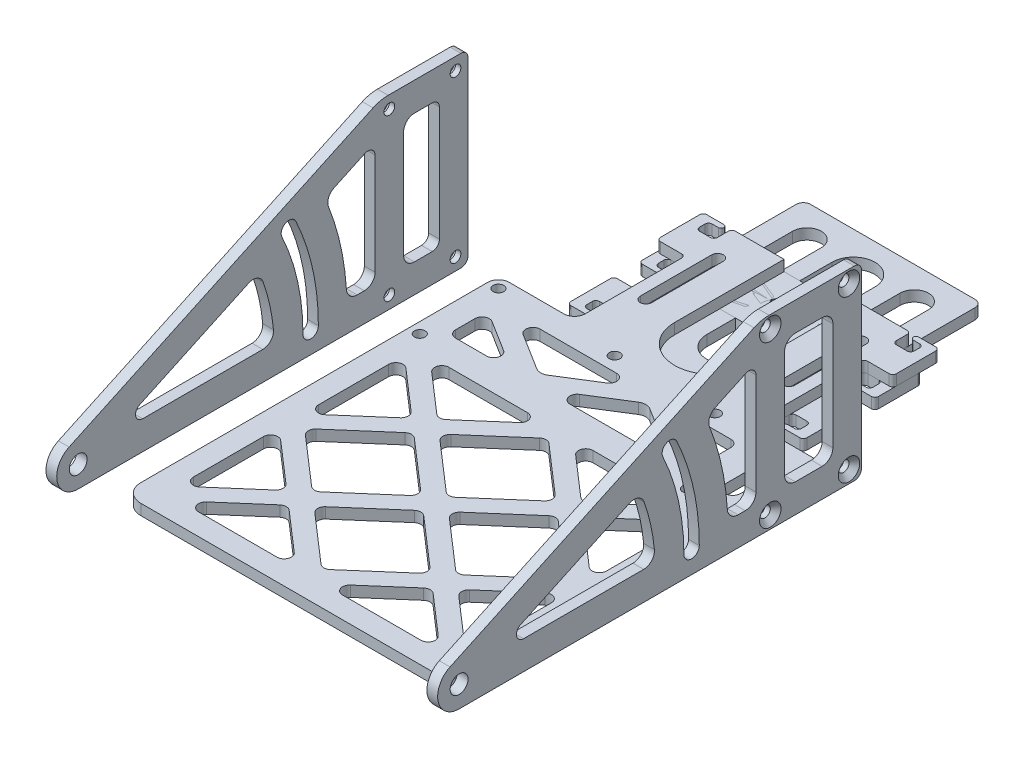
from build123d import *

# Parameters (mm, degrees)
EXTRUDE_START             = 51.75
SKETCH_1_R                = 1.5
SKETCH_1_R_2              = 2.5
EXTRUDE_1_DEPTH           = 3
HOLE_WIZARD_1_D           = 3
HOLE_WIZARD_1_CSINK_D     = 6
HOLE_WIZARD_1_CSINK_ANGLE = 90
CUT_EXTRUDE_2_DEPTH       = 122.355881604
SKETCH_2_R                = 3
EXTRUDE_2_DEPTH           = 3
SKETCH_4_R                = 1.5
SKETCH_4_W                = 3.5
SKETCH_4_H                = 52
CUT_EXTRUDE_1_DEPTH       = 164.427353892
MOVE_START                = 8
MOVE_FACE_1_OUTLINE_W     = 3
MOVE_FACE_1_OUTLINE_H     = 36
MOVE_FACE_1_DEPTH         = 3.5
FILLET_3_R                = 2
HOLE_WIZARD_2_AT_2_COUNT  = 2
HOLE_WIZARD_2_AT_2_PITCH  = 45
SKETCH_5_R                = 1.5
EXTRUDE_3_DEPTH           = 3
SKETCH_6_R                = 1.5
EXTRUDE_4_DEPTH           = 3
FILLET_1_R                = 1
FILLET_2_R                = 1
CUT_EXTRUDE_3_DEPTH       = 144.540595303
SKETCH_13_W               = 80.5
SKETCH_13_H               = 70
SKETCH_13_W_2             = 66.999999997
SKETCH_13_H_2             = 13.999999819
CUT_EXTRUDE_4_DEPTH       = 143.319016649
EXTRUDE_1_2_DEPTH         = 3
FILLET_4_R                = 3
FILLET_5_R                = 2
PATTERN_LINEAR_1_COUNT    = 2
PATTERN_LINEAR_1_PITCH    = 20


# Read off the part's stored shape, not the designer's step: 移动面1
with BuildPart() as part:
    # 草图1 → Extrude 1 (new body)
    with BuildSketch(Plane(origin=(0, 0, 0), x_dir=(0, 0, -1), z_dir=(1, 0, 0)).offset(EXTRUDE_START)):
        with BuildLine():
            Line((0, 24), (0, -24))
            ThreePointArc((0, -24), (-0.585786438, -25.414213562), (-2, -26))
            Line((-2, -26), (-112.5, -26))
            ThreePointArc((-112.5, -26), (-118.357776043, -21.298637684), (-115.03570957, -14.562153278))
            Line((-115.03570957, -14.562153278), (-30.059127146, 25.06307787))
            ThreePointArc((-30.059127146, 25.06307787), (-27.997340668, 25.762960071), (-25.832944529, 26))
            Line((-25.832944529, 26), (-2, 26))
            ThreePointArc((-2, 26), (-0.585786438, 25.414213562), (0, 24))
        make_face()
        with Locations((-3.5, 22.5)):
            Circle(SKETCH_1_R, mode=Mode.SUBTRACT)
        with Locations((-25.5, 22.5)):
            Circle(SKETCH_1_R, mode=Mode.SUBTRACT)
        with Locations(Location((-25.5, -22.5, 0), (0, 0, 180))):
            Circle(SKETCH_1_R, mode=Mode.SUBTRACT)
        with Locations(Location((-3.5, -22.5, 0), (0, 0, 180))):
            Circle(SKETCH_1_R, mode=Mode.SUBTRACT)
        with Locations((-112.5, -20)):
            Circle(SKETCH_1_R_2, mode=Mode.SUBTRACT)
        with BuildLine():
            ThreePointArc((-45.35, -20), (-46.941723122, -5.466079924), (-51.6414321, 8.378816276))
            ThreePointArc((-51.6414321, 8.378816276), (-54.498623105, 9.418748755), (-55.538555585, 6.56155775))
            ThreePointArc((-55.538555585, 6.56155775), (-51.139795953, -6.396770264), (-49.65, -20))
            ThreePointArc((-49.65, -20), (-47.5, -22.15), (-45.35, -20))
        make_face(mode=Mode.SUBTRACT)
    extrude(amount=EXTRUDE_1_DEPTH)

    # 孔1 (through all)
    with Locations(Plane(origin=(54.75, 0, 0), x_dir=(0, 0, -1), z_dir=(1, 0, 0))):
        with Locations((-25.5, 22.5), (-3.5, 22.5), (-3.5, -22.5), (-25.5, -22.5)):
            CounterSinkHole(HOLE_WIZARD_1_D / 2, HOLE_WIZARD_1_CSINK_D / 2, counter_sink_angle=HOLE_WIZARD_1_CSINK_ANGLE)

    # 草图11 → 切除-拉伸2 (cut, through all)
    with BuildSketch(Plane(origin=(54.75, 0, 0), x_dir=(0, 0, -1), z_dir=(1, 0, 0))):
        with BuildLine():
            Line((-34.510112835, -18), (-32.5, -18))
            ThreePointArc((-32.5, -18), (-30.378679656, -17.121320344), (-29.5, -15))
            Line((-29.5, -15), (-29.5, 13.357408635))
            ThreePointArc((-29.5, 13.357408635), (-30.425400783, 15.044191526), (-32.345236523, 15.170024209))
            Line((-32.345236523, 15.170024209), (-40.971921429, 11.147334973))
            ThreePointArc((-40.971921429, 11.147334973), (-42.488859957, 9.544174222), (-42.498536254, 7.337109822))
            ThreePointArc((-42.498536254, 7.337109822), (-39.131355065, -3.734563013), (-37.503966469, -15.19193858))
            ThreePointArc((-37.503966469, -15.19193858), (-36.562451046, -17.188128851), (-34.510112835, -18))
        make_face()
        with BuildLine():
            Line((-21.5, 15), (-21.5, -15))
            ThreePointArc((-21.5, -15), (-20.621320344, -17.121320344), (-18.5, -18))
            Line((-18.5, -18), (-11, -18))
            ThreePointArc((-11, -18), (-8.878679656, -17.121320344), (-8, -15))
            Line((-8, -15), (-8, 15))
            ThreePointArc((-8, 15), (-8.878679656, 17.121320344), (-11, 18))
            Line((-11, 18), (-18.5, 18))
            ThreePointArc((-18.5, 18), (-20.621320344, 17.121320344), (-21.5, 15))
        make_face()
        with BuildLine():
            Line((-64.881707759, -0.001981498), (-95.302402509, -14.187384426))
            ThreePointArc((-95.302402509, -14.187384426), (-96.409758, -16.432879228), (-94.457165985, -18))
            Line((-94.457165985, -18), (-60.891643119, -18))
            ThreePointArc((-60.891643119, -18), (-58.670394805, -17.016446362), (-57.905624398, -14.710703954))
            ThreePointArc((-57.905624398, -14.710703954), (-58.950164009, -8.128287175), (-60.785339163, -1.721150077))
            ThreePointArc((-60.785339163, -1.721150077), (-62.452905387, 0.045356282), (-64.881707759, -0.001981498))
        make_face()
    extrude(amount=-CUT_EXTRUDE_2_DEPTH, mode=Mode.SUBTRACT)


with BuildPart() as body_2:
    # 镜向1: mirrored copy
    add(part.part.mirror(Plane(origin=(0, 0, 0), x_dir=(0, 0, 1), z_dir=(1, 0, 0))))

    # 草图2 → 凸台-拉伸2 (add)
    with BuildSketch(Plane.ZY.offset(54.75)):
        with Locations((3.5, -22.5)):
            Circle(SKETCH_2_R)
        with Locations((3.5, 22.5)):
            Circle(SKETCH_2_R)
    extrude(amount=-EXTRUDE_2_DEPTH)

    # 草图4 → 切除-拉伸1 (cut, through all)
    with BuildSketch(Plane.ZY.offset(54.75)):
        with Locations((7, -22.5)):
            Circle(SKETCH_4_R)
        with Locations((7, 22.5)):
            Circle(SKETCH_4_R)
        with Locations((1.75, 0)):
            Rectangle(SKETCH_4_W, SKETCH_4_H)
    extrude(amount=-CUT_EXTRUDE_1_DEPTH, mode=Mode.SUBTRACT)

    # Move Face 1 outline → Move Face 1 (add)
    with BuildSketch(Plane.XY.offset(MOVE_START)):
        with Locations((-53.25, 0)):
            Rectangle(MOVE_FACE_1_OUTLINE_W, MOVE_FACE_1_OUTLINE_H)
    extrude(amount=MOVE_FACE_1_DEPTH)

    # 圆角3
    fillet_3_edges = [body_2.edges().sort_by_distance(p)[0] for p in [
        (-53.25, 18, 11.5),
        (-53.25, -18, 11.5),
        (-53.25, 26, 3.5),
        (-53.25, -26, 3.5),
    ]]
    fillet(fillet_3_edges, radius=FILLET_3_R)

    # 草图10 → 孔2 (revolve, cut)
    with BuildSketch(Plane(origin=(-54.75, 22.5, 7), x_dir=(0, 0, 1), z_dir=(0, 1, 0))):
        Polygon((0, 0), (0, 109.5), (1.5, 109.5), (1.5, 1.5), (3, 0), align=None)
    hole_wizard_2 = revolve(axis=Axis((-61.195314094, 22.5, 7), (1, 0, 0)), mode=Mode.SUBTRACT)

    # 孔2 at 2: 孔2 ×2
    with Locations(*[(0, -i * HOLE_WIZARD_2_AT_2_PITCH, 0) for i in range(1, HOLE_WIZARD_2_AT_2_COUNT)]):
        add(hole_wizard_2, mode=Mode.SUBTRACT)


with BuildPart() as body_3:
    # 草图5 → 凸台-拉伸3 (new body)
    with BuildSketch(Plane(origin=(0, -27.7, 0), x_dir=(-1, 0, 0), z_dir=(0, -1, 0))):
        with BuildLine():
            Line((-33, 43.5), (-27.25, 43.5))
            ThreePointArc((-27.25, 43.5), (-26.5, 42.75), (-27.25, 42))
            Line((-27.25, 42), (-30, 42))
            Line((-30, 42), (-30, 38.5))
            Line((-30, 38.5), (-25, 38.5))
            Line((-25, 38.5), (-25, 43.5))
            Line((-25, 43.5), (25, 43.5))
            Line((25, 43.5), (25, 38.5))
            Line((25, 38.5), (30, 38.5))
            Line((30, 38.5), (30, 42))
            Line((30, 42), (27.25, 42))
            ThreePointArc((27.25, 42), (26.5, 42.75), (27.25, 43.5))
            Line((27.25, 43.5), (33, 43.5))
            Line((33, 43.5), (33, 30.5))
            Line((33, 30.5), (25, 30.5))
            Line((25, 30.5), (25, 2.5))
            ThreePointArc((25, 2.5), (25.878679656, 0.378679656), (28, -0.5))
            Line((28, -0.5), (43.25, -0.5))
            ThreePointArc((43.25, -0.5), (45.371320344, -1.378679656), (46.25, -3.5))
            Line((46.25, -3.5), (46.25, -100.499999819))
            ThreePointArc((46.25, -100.499999819), (44.785533906, -104.035533725), (41.25, -105.499999819))
            Line((41.25, -105.499999819), (-41.25, -105.499999819))
            ThreePointArc((-41.25, -105.499999819), (-44.785533906, -104.035533725), (-46.25, -100.499999819))
            Line((-46.25, -100.499999819), (-46.25, -3.5))
            ThreePointArc((-46.25, -3.5), (-45.371320344, -1.378679656), (-43.25, -0.5))
            Line((-43.25, -0.5), (-28, -0.5))
            ThreePointArc((-28, -0.5), (-25.878679656, 0.378679656), (-25, 2.5))
            Line((-25, 2.5), (-25, 30.5))
            Line((-25, 30.5), (-33, 30.5))
            Line((-33, 30.5), (-33, 43.5))
        make_face()
        with Locations(Location((-31.749999997, -25.499999819, 0), (0, 0, 90))):
            Circle(SKETCH_5_R, mode=Mode.SUBTRACT)
        with Locations(Location((10.750003407, -3.5, 0), (0, 0, 90))):
            Circle(SKETCH_5_R, mode=Mode.SUBTRACT)
        with Locations(Location((-17.249996593, -3.5, 0), (0, 0, 90))):
            Circle(SKETCH_5_R, mode=Mode.SUBTRACT)
        with Locations(Location((-31.749999997, -3.5, 0), (0, 0, 90))):
            Circle(SKETCH_5_R, mode=Mode.SUBTRACT)
        with Locations(Location((43.25, -3.5, 0), (0, 0, 90))):
            Circle(SKETCH_5_R, mode=Mode.SUBTRACT)
        with Locations(Location((43.25, -25.499999819, 0), (0, 0, 90))):
            Circle(SKETCH_5_R, mode=Mode.SUBTRACT)
        with BuildLine():
            Line((-18.4, 34.5), (-18.4, 14.5))
            ThreePointArc((-18.4, 14.5), (-20, 12.9), (-21.6, 14.5))
            Line((-21.6, 14.5), (-21.6, 34.5))
            ThreePointArc((-21.6, 34.5), (-20, 36.1), (-18.4, 34.5))
        make_face(mode=Mode.SUBTRACT)
        with BuildLine():
            Line((18.4, 34.5), (18.4, 14.5))
            ThreePointArc((18.4, 14.5), (20, 12.9), (21.6, 14.5))
            Line((21.6, 14.5), (21.6, 34.5))
            ThreePointArc((21.6, 34.5), (20, 36.1), (18.4, 34.5))
        make_face(mode=Mode.SUBTRACT)
    extrude(amount=EXTRUDE_3_DEPTH)

    # 圆角1
    fillet_1_edges = [body_3.edges().sort_by_distance(p)[0] for p in [
        (25, -29.2, -30.5),
        (33, -29.2, -30.5),
        (33, -29.2, -43.5),
        (30, -29.2, -42),
        (30, -29.2, -38.5),
        (25, -29.2, -38.5),
        (25, -29.2, -43.5),
        (-25, -29.2, -43.5),
        (-25, -29.2, -38.5),
        (-30, -29.2, -38.5),
        (-30, -29.2, -42),
        (-33, -29.2, -43.5),
        (-33, -29.2, -30.5),
        (-25, -29.2, -30.5),
    ]]
    fillet(fillet_1_edges, radius=FILLET_1_R)

    # 草图13 → 切除-拉伸4 (cut, through all)
    with BuildSketch(Plane.XZ.offset(30.7)):
        with Locations((0, 64.499999819)):
            Rectangle(SKETCH_13_W, SKETCH_13_H)
        with Locations((-5.750000001, 14.49999991)):
            Rectangle(SKETCH_13_W_2, SKETCH_13_H_2)
        with BuildLine():
            Line((40.25, 19.249999818), (40.25, 9.750000002))
            ThreePointArc((40.25, 9.750000002), (37.999999998, 7.5), (35.749999997, 9.750000002))
            Line((35.749999997, 9.750000002), (35.749999997, 19.249999818))
            ThreePointArc((35.749999997, 19.249999818), (37.999999998, 21.499999819), (40.25, 19.249999818))
        make_face()
        with BuildLine():
            Line((-10.4, -43.5), (-10.4, -12.9))
            ThreePointArc((-10.4, -12.9), (0, -2.5), (10.4, -12.9))
            Line((10.4, -12.9), (10.4, -43.5))
            ThreePointArc((10.4, -43.5), (0, -53.9), (-10.4, -43.5))
        make_face()
    extrude(amount=-CUT_EXTRUDE_4_DEPTH, mode=Mode.SUBTRACT)

    # 草图14 → Extrude 1 2 (add)
    # profile 1 of 4: a face of its own
    with BuildSketch(Plane.XZ.offset(30.7)):
        Polygon((-37.922162038, 5.381782271), (-16.916666668, 18.549406065), (5.416666664, 4.549406246), (29.077837959, 19.381782091), (26.422162034, 23.618217548), (5.416666664, 10.450593754), (-16.916666668, 24.450593573), (-40.577837962, 9.618217729), align=None)
    # profile 2 of 4: a face of its own
    with BuildSketch(Plane.XZ.offset(30.7)):
        Polygon((-41.890446787, 97.613486014), (38.609553213, 27.613486014), (41.890446787, 31.386513625), (-38.609553213, 101.386513625), align=None)
    # profile 3 of 4: a face of its own
    with BuildSketch(Plane.XZ.offset(30.7)):
        Polygon((-38.609553213, 27.613486014), (41.890446787, 97.613486014), (38.609553213, 101.386513625), (-41.890446787, 31.386513625), align=None)
    # profile 4 of 4: a face of its own
    with BuildSketch(Plane.XZ.offset(30.7)):
        Polygon((0, 102.812989092), (-44.059937664, 64.499999819), (0, 26.187010547), (44.059937664, 64.499999819), align=None)
        Polygon((0, 96.187010547), (-36.440062336, 64.499999819), (0, 32.812989092), (36.440062336, 64.499999819), align=None, mode=Mode.SUBTRACT)
    extrude(amount=-EXTRUDE_1_2_DEPTH)

    # 圆角4
    fillet_4_edges = [body_3.edges().sort_by_distance(p)[0] for p in [
        (5.416666664, -29.2, 10.450593754),
        (-16.916666668, -29.2, 18.549406065),
    ]]
    fillet(fillet_4_edges, radius=FILLET_4_R)

    # 圆角5
    fillet_5_edges = [body_3.edges().sort_by_distance(p)[0] for p in [
        (-39.25, -29.2, 21.499999819),
        (27.749999997, -29.2, 7.5),
        (-34.54310038, -29.2, 7.5),
        (0.709767044, -29.2, 7.5),
        (10.123566285, -29.2, 7.5),
        (23.043100376, -29.2, 21.499999819),
        (-12.209767047, -29.2, 21.499999819),
        (-21.623566288, -29.2, 21.499999819),
        (-39.25, -29.2, 10.450593754),
        (27.749999997, -29.2, 18.549406065),
        (-3.809937664, -29.2, 29.499999819),
        (3.809937664, -29.2, 29.499999819),
        (-36.440062336, -29.2, 29.499999819),
        (36.440062336, -29.2, 29.499999819),
        (40.25, -29.2, 61.187010547),
        (40.25, -29.2, 67.812989092),
        (40.25, -29.2, 96.187010547),
        (40.25, -29.2, 32.812989092),
        (-3.809937664, -29.2, 99.499999819),
        (3.809937664, -29.2, 99.499999819),
        (36.440062336, -29.2, 99.499999819),
        (-36.440062336, -29.2, 99.499999819),
        (-40.25, -29.2, 61.187010547),
        (-40.25, -29.2, 67.812989092),
        (-40.25, -29.2, 32.812989092),
        (-40.25, -29.2, 96.187010547),
        (-23.934937664, -29.2, 46.999999819),
        (-23.934937664, -29.2, 81.999999819),
        (-20.125, -29.2, 85.312989092),
        (20.125, -29.2, 85.312989092),
        (23.934937664, -29.2, 46.999999819),
        (23.934937664, -29.2, 81.999999819),
        (20.125, -29.2, 43.687010547),
        (-20.125, -29.2, 43.687010547),
        (-3.809937664, -29.2, 64.499999819),
        (-20.125, -29.2, 78.687010547),
        (16.315062336, -29.2, 46.999999819),
        (3.809937664, -29.2, 64.499999819),
        (16.315062336, -29.2, 81.999999819),
        (36.440062336, -29.2, 64.499999819),
        (-16.315062336, -29.2, 81.999999819),
        (0, -29.2, 96.187010547),
        (20.125, -29.2, 50.312989092),
        (0, -29.2, 67.812989092),
        (20.125, -29.2, 78.687010547),
        (0, -29.2, 61.187010547),
        (-16.315062336, -29.2, 46.999999819),
        (-20.125, -29.2, 50.312989092),
        (-36.440062336, -29.2, 64.499999819),
        (0, -29.2, 32.812989092),
    ]]
    fillet(fillet_5_edges, radius=FILLET_5_R)


with BuildPart() as body_4:
    # 草图6 → 凸台-拉伸4 (new body)
    with BuildSketch(Plane.XZ.offset(30.7)):
        with BuildLine():
            Line((30, -30.5), (25, -30.5))
            Line((25, -30.5), (25, -25.5))
            Line((25, -25.5), (-25, -25.5))
            Line((-25, -25.5), (-25, -30.5))
            Line((-25, -30.5), (-30, -30.5))
            Line((-30, -30.5), (-30, -27))
            Line((-30, -27), (-27.25, -27))
            ThreePointArc((-27.25, -27), (-26.5, -26.25), (-27.25, -25.5))
            Line((-27.25, -25.5), (-33, -25.5))
            Line((-33, -25.5), (-33, -38.5))
            Line((-33, -38.5), (-25, -38.5))
            Line((-25, -38.5), (-25, -61.5))
            ThreePointArc((-25, -61.5), (-24.414213562, -62.914213562), (-23, -63.5))
            Line((-23, -63.5), (23, -63.5))
            ThreePointArc((23, -63.5), (24.414213562, -62.914213562), (25, -61.5))
            Line((25, -61.5), (25, -38.5))
            Line((25, -38.5), (33, -38.5))
            Line((33, -38.5), (33, -25.5))
            Line((33, -25.5), (27.25, -25.5))
            ThreePointArc((27.25, -25.5), (26.5, -26.25), (27.25, -27))
            Line((27.25, -27), (30, -27))
            Line((30, -27), (30, -30.5))
        make_face()
        with Locations(Location((20, -34.5, 0), (0, 0, 270))):
            Circle(SKETCH_6_R, mode=Mode.SUBTRACT)
        with Locations(Location((-20, -34.5, 0), (0, 0, 90))):
            Circle(SKETCH_6_R, mode=Mode.SUBTRACT)
    extrude(amount=EXTRUDE_4_DEPTH)

    # 圆角2
    fillet_2_edges = [body_4.edges().sort_by_distance(p)[0] for p in [
        (25, -32.2, -30.5),
        (30, -32.2, -30.5),
        (30, -32.2, -27),
        (33, -32.2, -25.5),
        (33, -32.2, -38.5),
        (25, -32.2, -38.5),
        (-25, -32.2, -38.5),
        (-33, -32.2, -38.5),
        (-33, -32.2, -25.5),
        (-30, -32.2, -27),
        (-30, -32.2, -30.5),
        (-25, -32.2, -30.5),
        (-25, -32.2, -25.5),
        (25, -32.2, -25.5),
    ]]
    fillet(fillet_2_edges, radius=FILLET_2_R)

    # 草图12 → 切除-拉伸3 (cut, through all)
    with BuildSketch(Plane.XZ.offset(33.7)):
        with BuildLine():
            Line((-11, -42.5), (-11, -54.5))
            ThreePointArc((-11, -54.5), (-15, -58.5), (-19, -54.5))
            Line((-19, -54.5), (-19, -42.5))
            ThreePointArc((-19, -42.5), (-15, -38.5), (-11, -42.5))
        make_face()
        with BuildLine():
            Line((6, -37.5), (6, -52.5))
            ThreePointArc((6, -52.5), (0, -58.5), (-6, -52.5))
            Line((-6, -52.5), (-6, -37.5))
            ThreePointArc((-6, -37.5), (0, -31.5), (6, -37.5))
        make_face()
        with BuildLine():
            Line((11, -42.5), (11, -54.5))
            ThreePointArc((11, -54.5), (15, -58.5), (19, -54.5))
            Line((19, -54.5), (19, -42.5))
            ThreePointArc((19, -42.5), (15, -38.5), (11, -42.5))
        make_face()
    extrude(amount=-CUT_EXTRUDE_3_DEPTH, mode=Mode.SUBTRACT)


with BuildPart() as pattern_linear_1_1:
    # 阵列(线性)1: pattern copy
    add(body_4.part.moved(Location(Vector(0, 0, 1) * (1 * PATTERN_LINEAR_1_PITCH))))


solid = Compound([part.part, body_2.part, body_3.part, body_4.part, pattern_linear_1_1.part])
